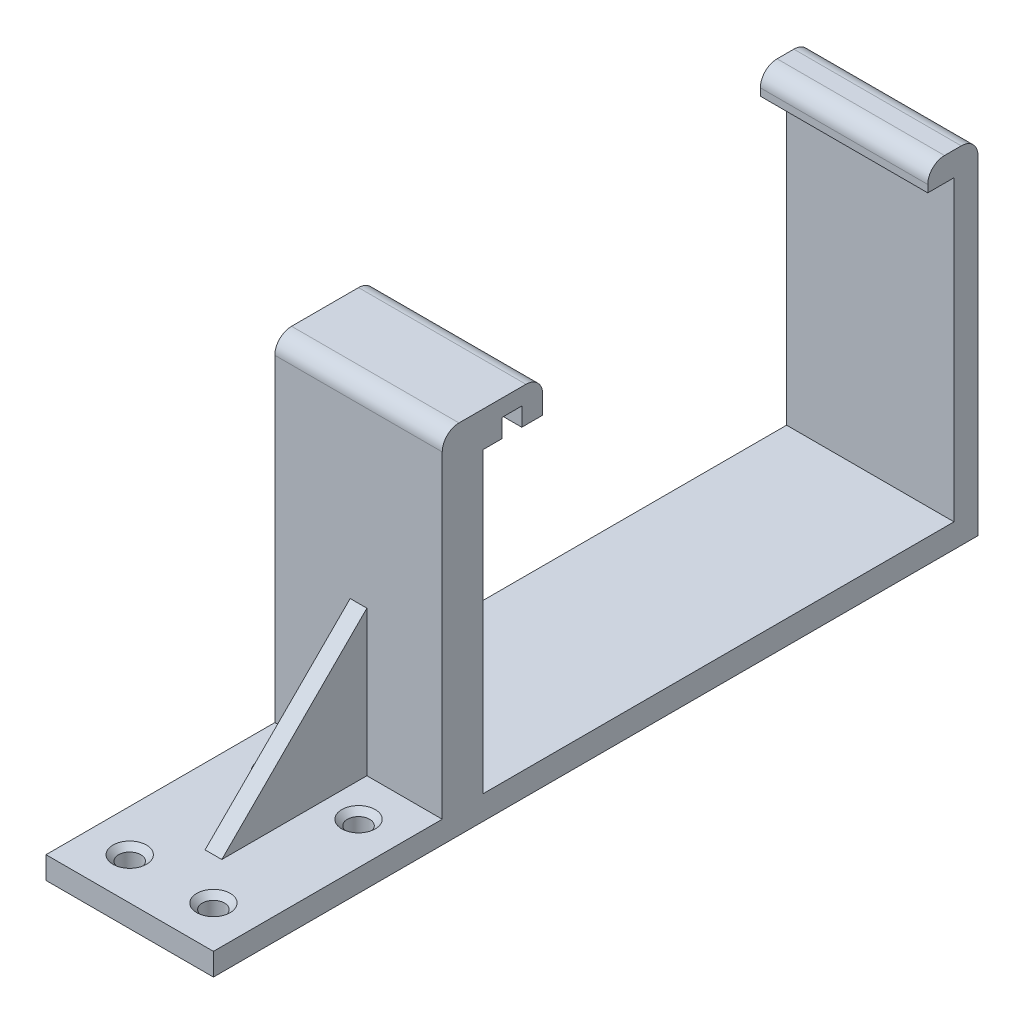
from build123d import *

# Parameters (mm, degrees)
SKETCH1_W           = 30
SKETCH1_H           = 45
BOSS_EXTRUDE1_DEPTH = 4
SKETCH2_W           = 30
SKETCH2_H           = 4
BOSS_EXTRUDE2_DEPTH = 58
SKETCH7_W           = 3
SKETCH7_H           = 41
BOSS_EXTRUDE3_DEPTH = 41
CUT_EXTRUDE1_DEPTH  = 3
SKETCH10_R          = 2
CUT_EXTRUDE2_DEPTH  = 4
CHAMFER1_SIZE       = 1
BOSS_EXTRUDE4_DEPTH = 15
SKETCH12_W          = 3.5
SKETCH12_H          = 3
CUT_EXTRUDE3_DEPTH  = 30
SKETCH13_W          = 18
SKETCH13_H          = 2
BOSS_EXTRUDE5_DEPTH = 30
SKETCH14_W          = 1
SKETCH14_H          = 54
CUT_EXTRUDE4_DEPTH  = 30
SKETCH15_W          = 3.75
SKETCH15_H          = 0.3
BOSS_EXTRUDE6_DEPTH = 30
FILLET1_R           = 3


with BuildPart() as part:
    # Sketch1 → Boss-Extrude1 (new body)
    with BuildSketch(Plane(origin=(0, 0, 0), x_dir=(1, 0, 0), z_dir=(0, 1, 0))):
        with Locations((15, 22.5)):
            Rectangle(SKETCH1_W, SKETCH1_H)
    extrude(amount=BOSS_EXTRUDE1_DEPTH)

    # Sketch2 → Boss-Extrude2 (add)
    with BuildSketch(Plane(origin=(0, 4, 0), x_dir=(1, 0, 0), z_dir=(0, 1, 0))):
        with Locations((15, 43)):
            Rectangle(SKETCH2_W, SKETCH2_H)
    extrude(amount=BOSS_EXTRUDE2_DEPTH)

    # Sketch7 → Boss-Extrude3 (add)
    with BuildSketch(Plane(origin=(0, 4, 0), x_dir=(1, 0, 0), z_dir=(0, 1, 0))):
        with Locations((15, 20.5)):
            Rectangle(SKETCH7_W, SKETCH7_H)
    extrude(amount=BOSS_EXTRUDE3_DEPTH)

    # Sketch8 → Cut-Extrude1 (cut)
    with BuildSketch(Plane(origin=(16.5, 0, 0), x_dir=(0, 0, -1), z_dir=(1, 0, 0))):
        Polygon((41, 45), (0, 45), (0, 4), (15, 4), (41, 30), align=None)
    extrude(amount=-CUT_EXTRUDE1_DEPTH, mode=Mode.SUBTRACT)

    # Sketch10 → Cut-Extrude2 (cut)
    with BuildSketch(Plane(origin=(0, 4, 0), x_dir=(1, 0, 0), z_dir=(0, 1, 0))):
        with Locations(Location((7.5, 7.5, 0), (0, 0, 270))):
            Circle(SKETCH10_R)
        with Locations(Location((22.5, 7.5, 0), (0, 0, 270))):
            Circle(SKETCH10_R)
        with Locations(Location((22.5, 33.5, 0), (0, 0, 90))):
            Circle(SKETCH10_R)
        with Locations(Location((7.5, 33.5, 0), (0, 0, 90))):
            Circle(SKETCH10_R)
    extrude(amount=-CUT_EXTRUDE2_DEPTH, mode=Mode.SUBTRACT)

    # Chamfer1
    chamfer1_edges = [part.edges().sort_by_distance(p)[0] for p in [
        (7.5, 4, -31.5),
        (22.5, 4, -31.5),
        (22.5, 4, -9.5),
        (7.5, 4, -9.5),
    ]]
    chamfer(chamfer1_edges, length=CHAMFER1_SIZE)

    # Sketch11 → Boss-Extrude4 (add, symmetric)
    with BuildSketch(Plane(origin=(15, 0, 0), x_dir=(0, 0, -1), z_dir=(1, 0, 0))):
        Polygon((45, 0), (137, 0), (137, 62), (128, 62), (128, 58), (133, 58), (133, 4), (49, 4), (49, 58), (59, 58), (59, 62), (45, 62), align=None)
    extrude(amount=BOSS_EXTRUDE4_DEPTH, both=True)

    # Sketch12 → Cut-Extrude3 (cut)
    with BuildSketch(Plane.ZY):
        with Locations((-53.5, 59.5)):
            Rectangle(SKETCH12_W, SKETCH12_H)
    extrude(amount=-CUT_EXTRUDE3_DEPTH, mode=Mode.SUBTRACT)

    # Sketch13 → Boss-Extrude5 (add)
    with BuildSketch(Plane(origin=(30, 0, 0), x_dir=(0, 0, -1), z_dir=(1, 0, 0))):
        with Locations((50, 63)):
            Rectangle(SKETCH13_W, SKETCH13_H)
    extrude(amount=-BOSS_EXTRUDE5_DEPTH)

    # Sketch14 → Cut-Extrude4 (cut)
    with BuildSketch(Plane.ZY):
        with Locations((-48.5, 31)):
            Rectangle(SKETCH14_W, SKETCH14_H)
    extrude(amount=-CUT_EXTRUDE4_DEPTH, mode=Mode.SUBTRACT)

    # Sketch15 → Boss-Extrude6 (add)
    with BuildSketch(Plane.ZY):
        with Locations((-57.125, 57.85)):
            Rectangle(SKETCH15_W, SKETCH15_H)
        Polygon((-51.75, 58), (-51.75, 57.7), (-48.3, 57.7), (-48.3, 4.3), (-132.7, 4.3), (-132.7, 57.7), (-128, 57.7), (-128, 58), (-133, 58), (-133, 4), (-48, 4), (-48, 58), align=None)
    extrude(amount=-BOSS_EXTRUDE6_DEPTH)

    # Fillet1
    fillet1_edges = [part.edges().sort_by_distance(p)[0] for p in [
        (15, 64, -41),
        (15, 64, -59),
        (15, 62, -128),
        (15, 62, -137),
    ]]
    fillet(fillet1_edges, radius=FILLET1_R)


solid = part.part
